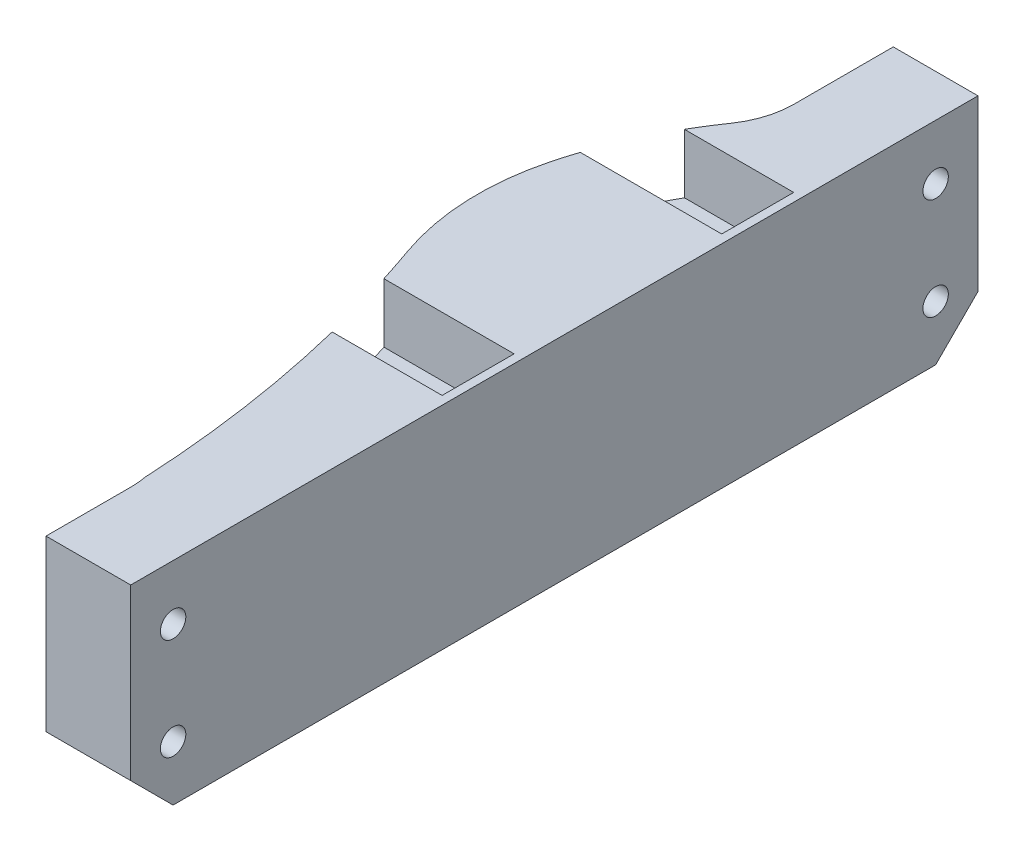
from build123d import *

# Parameters (mm, degrees)
SKETCH_1_W          = 8
SKETCH_1_H          = 4.2
EXTRUDE_1_DEPTH     = 25
SKETCH_2_R          = 1.5
CUT_EXTRUDE_1_DEPTH = 57.789083458
SKETCH_3_R          = 1.5
CUT_EXTRUDE_2_DEPTH = 57.789083458
FILLET_7_R          = 1.5
CHAMFER_1_SIZE      = 5
FILLET_8_R          = 10
CUT_EXTRUDE1_START  = -25
SKETCH1_W           = 19
SKETCH1_H           = 8.5
CUT_EXTRUDE1_DEPTH  = 7
CHAMFER1_START      = -19
CHAMFER1_OUTLINE_W  = 27
CHAMFER1_OUTLINE_H  = 17
CHAMFER1_DEPTH      = 4.338795771
CUT_EXTRUDE2_DEPTH  = 57.789083458
FILLET1_R           = 30
FILLET2_R           = 10


with BuildPart() as part:
    # Эскиз1 → Бобышка-Вытянуть1 (new body)
    with BuildSketch(Plane(origin=(0, 0, 0), x_dir=(1, 0, 0), z_dir=(0, 1, 0))):
        Polygon((-10, -30), (0, -30), (0, -50), (10, -50), (10, 50), (0, 50), (0, 30), (-10, 30), align=None)
        with Locations((4, 25)):
            Rectangle(SKETCH_1_W, SKETCH_1_H, mode=Mode.SUBTRACT)
        with Locations((4, -8)):
            Rectangle(SKETCH_1_W, SKETCH_1_H, mode=Mode.SUBTRACT)
    extrude(amount=EXTRUDE_1_DEPTH)

    # Эскиз2 → Вырез-Вытянуть1 (cut, through all)
    with BuildSketch(Plane.ZY):
        with Locations((-45, 6.5)):
            Circle(SKETCH_2_R)
        with Locations((-45, 18.5)):
            Circle(SKETCH_2_R)
    extrude(amount=-CUT_EXTRUDE_1_DEPTH, mode=Mode.SUBTRACT)

    # Эскиз3 → Вырез-Вытянуть2 (cut, through all)
    with BuildSketch(Plane.ZY):
        with Locations((45, 6.5)):
            Circle(SKETCH_3_R)
        with Locations((45, 18.5)):
            Circle(SKETCH_3_R)
    extrude(amount=-CUT_EXTRUDE_2_DEPTH, mode=Mode.SUBTRACT)

    # Скругление7
    fillet_7_edges = [part.edges().sort_by_distance(p)[0] for p in [
        (0, 12.5, 5.9),
        (0, 12.5, 10.1),
        (8, 12.5, 10.1),
        (8, 12.5, 5.9),
        (0, 12.5, -22.9),
        (8, 12.5, -22.9),
        (8, 12.5, -27.1),
        (0, 12.5, -27.1),
    ]]
    fillet(fillet_7_edges, radius=FILLET_7_R)

    # Фаска1
    chamfer_1_edges = [part.edges().sort_by_distance(p)[0] for p in [
        (5, 0, -50),
        (5, 0, 50),
    ]]
    chamfer(chamfer_1_edges, length=CHAMFER_1_SIZE)

    # Скругление8
    fillet_8_edges = [part.edges().sort_by_distance(p)[0] for p in [
        (0, 12.5, 30),
        (0, 12.5, -30),
    ]]
    fillet(fillet_8_edges, radius=FILLET_8_R - 0.0001)  # a hair under: the kernel refuses the full size

    # Sketch1 → Cut-Extrude1 (cut)
    with BuildSketch(Plane.XZ.offset(CUT_EXTRUDE1_START)):
        with Locations((-0.5, 8)):
            Rectangle(SKETCH1_W, SKETCH1_H)
        with Locations((-0.5, -25)):
            Rectangle(SKETCH1_W, SKETCH1_H)
    extrude(amount=CUT_EXTRUDE1_DEPTH, mode=Mode.SUBTRACT)

    # Chamfer1: read off the stored shape, not the designer's step
    # Chamfer1 outline → Chamfer1 (cut)
    with BuildSketch(Plane(origin=(0, 0, 0), x_dir=(0, 1, 0), z_dir=(0.9555233585367056, 0, -0.29491543074368715)).offset(CHAMFER1_START)):
        with Locations((12.5, 20.5)):
            Rectangle(CHAMFER1_OUTLINE_W, CHAMFER1_OUTLINE_H)
    extrude(amount=CHAMFER1_DEPTH, mode=Mode.SUBTRACT)

    # Sketch2 → Cut-Extrude2 (cut, through all)
    with BuildSketch(Plane.XZ):
        with BuildLine():
            Line((0, -45), (0, -35))
            ThreePointArc((0, -35), (-7.428201086, -21.519007807), (-10, -6.343330813))
            ThreePointArc((-10, -6.343330813), (-2.523269625, 18.845948598), (0, 45))
            Line((0, 45), (-34.074661068, 45))
            Line((-34.074661068, 45), (-32.754387418, -45))
            Line((-32.754387418, -45), (0, -45))
        make_face()
    extrude(amount=-CUT_EXTRUDE2_DEPTH, mode=Mode.SUBTRACT)

    # Fillet1
    fillet1_edges = [part.edges().sort_by_distance(p)[0] for p in [
        (-10, 12.5, -6.343330813),
    ]]
    fillet(fillet1_edges, radius=FILLET1_R)

    # Fillet2
    fillet2_edges = [part.edges().sort_by_distance(p)[0] for p in [
        (0, 12.5, -35),
    ]]
    fillet(fillet2_edges, radius=FILLET2_R)


solid = part.part
